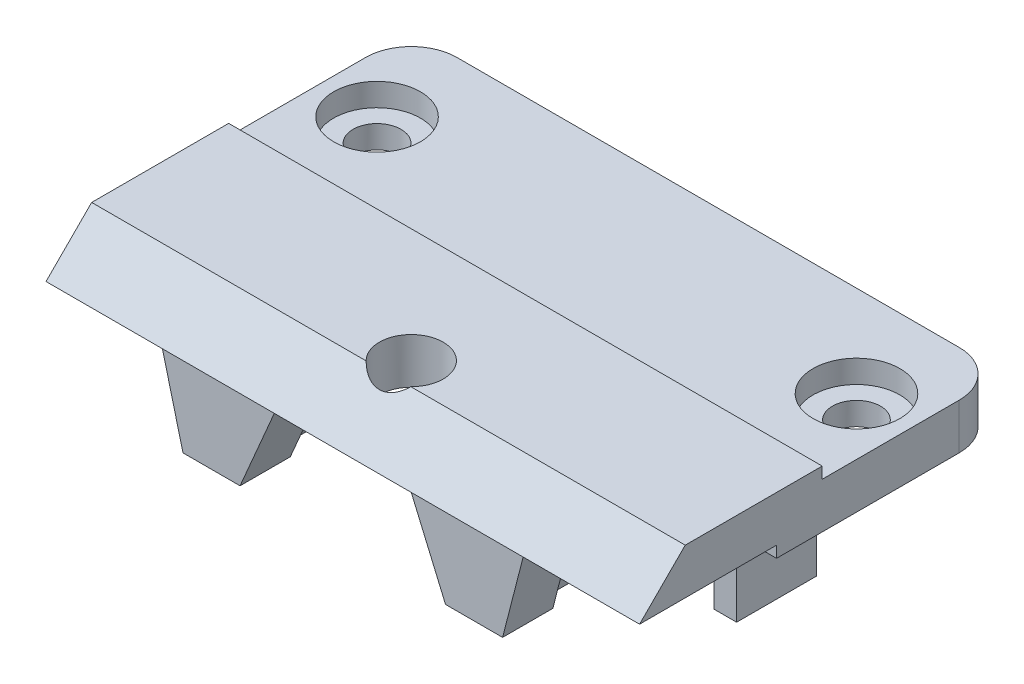
from build123d import *

# Parameters (mm, degrees)
SKETCH_1_W                   = 26
SKETCH_1_H                   = 16
EXTRUDE_1_DEPTH              = 2
EXTRUDE_3_DEPTH              = 6
CUT_EXTRUDE_1_REACH          = 18.225
SKETCH_5_R                   = 1.4
EXTRUDE_4_REACH              = 29.427
SKETCH_6_W                   = 10
SKETCH_6_H                   = 0.5
CUT_EXTRUDE_2_REACH          = 29.427
SKETCH_7_W                   = 8
SKETCH_7_H                   = 0.5
HOLE_WIZARD_M2_1_D           = 2.1
HOLE_WIZARD_M2_1_CBORE_D     = 3.8
HOLE_WIZARD_M2_1_CBORE_DEPTH = 1
SKETCH_10_W                  = 1
SKETCH_10_H                  = 3.5
EXTRUDE_5_DEPTH              = 3.3
CHAMFER_1_SIZE               = 2
FILLET_2_R                   = 2
CUT_EXTRUDE_3_DEPTH          = 0.8


with BuildPart() as part:
    # ｽｹｯﾁ1 → ﾎﾞｽ - 押し出し1 (new body)
    with BuildSketch(Plane(origin=(0, 0, 0), x_dir=(1, 0, 0), z_dir=(0, 1, 0))):
        Rectangle(SKETCH_1_W, SKETCH_1_H)
    extrude(amount=EXTRUDE_1_DEPTH)

    # ｽｹｯﾁ4 → ﾎﾞｽ - 押し出し3 (add)
    with BuildSketch(Plane.XY.offset(8)):
        Polygon((-7, -3.5), (-4.5, -3.5), (-3, 0), (-7.9, 0), align=None)
        Polygon((3, 0), (4.5, -3.5), (7, -3.5), (7.9, 0), align=None)
    extrude(amount=-EXTRUDE_3_DEPTH)

    # ｽｹｯﾁ5 → ｶｯﾄ - 押し出し1 (cut, up to next)
    with BuildSketch(Plane(origin=(0, 2, 0), x_dir=(1, 0, 0), z_dir=(0, 1, 0)), mode=Mode.PRIVATE) as cut_extrude_1_sk1:
        with Locations(Location((0, -5, 0), (0, 0, 270))):
            Circle(SKETCH_5_R)
    cut_extrude_1_tool1 = extrude(cut_extrude_1_sk1.sketch, amount=-CUT_EXTRUDE_1_REACH, mode=Mode.PRIVATE) & part.part
    add(cut_extrude_1_tool1.solids().sort_by_distance((0, 2, 5))[0], mode=Mode.SUBTRACT)

    # ﾎﾞｽ - 押し出し4: up to this face of the body (flat: up to its plane)
    extrude_4_end = Plane(part.part.faces().sort_by_distance((-13, 1, 0))[0])
    # ｽｹｯﾁ6 → ﾎﾞｽ - 押し出し4 (add, up to the picked face)
    with BuildSketch(Plane(origin=(13, 0, 0), x_dir=(0, 0, -1), z_dir=(1, 0, 0)), mode=Mode.PRIVATE) as extrude_4_sk1:
        with Locations((3, -0.25)):
            Rectangle(SKETCH_6_W, SKETCH_6_H)
    extrude_4_tool1 = split(extrude(extrude_4_sk1.sketch, amount=-EXTRUDE_4_REACH, mode=Mode.PRIVATE), bisect_by=extrude_4_end, keep=Keep.BOTH, mode=Mode.PRIVATE)
    add(extrude_4_tool1.solids().sort_by(Axis((13, -0.25, -3), (-1, 0, 0)))[0])

    # ｽｹｯﾁ7 → ｶｯﾄ - 押し出し2 (cut, up to next)
    with BuildSketch(Plane(origin=(13, 0, 0), x_dir=(0, 0, -1), z_dir=(1, 0, 0)), mode=Mode.PRIVATE) as cut_extrude_2_sk1:
        with Locations((4, 1.75)):
            Rectangle(SKETCH_7_W, SKETCH_7_H)
    cut_extrude_2_tool1 = extrude(cut_extrude_2_sk1.sketch, amount=-CUT_EXTRUDE_2_REACH, mode=Mode.PRIVATE) & part.part
    add(cut_extrude_2_tool1.solids().sort_by_distance((13, 1.75, -4))[0], mode=Mode.SUBTRACT)

    # M2 丸平ねじ用座ぐり穴1 (through all)
    with Locations(Plane(origin=(0, 1.5, 0), x_dir=(1, 0, 0), z_dir=(0, 1, 0))):
        with Locations((10.5, 4)):
            hole_wizard_m2_1 = CounterBoreHole(HOLE_WIZARD_M2_1_D / 2, HOLE_WIZARD_M2_1_CBORE_D / 2, HOLE_WIZARD_M2_1_CBORE_DEPTH)

    # ｽｹｯﾁ10 → ﾎﾞｽ - 押し出し5 (add)
    with BuildSketch(Plane.XZ.offset(0.5)):
        with Locations((10.75, 0.25)):
            Rectangle(SKETCH_10_W, SKETCH_10_H)
    extrude_5 = extrude(amount=EXTRUDE_5_DEPTH)

    # ﾐﾗｰ1: M2 丸平ねじ用座ぐり穴1, ﾎﾞｽ - 押し出し5 across plane
    add(hole_wizard_m2_1.mirror(Plane(origin=(0, 0, 0), x_dir=(0, 0, 1), z_dir=(1, 0, 0))), mode=Mode.SUBTRACT)
    add(extrude_5.mirror(Plane(origin=(0, 0, 0), x_dir=(0, 0, 1), z_dir=(1, 0, 0))))

    # 面取り1
    # the kernel refuses this chamfer: 2 mm, written as the material it takes off along each edge
    with BuildSketch(Plane(origin=(18.143365976, 2, 8), x_dir=(0, 0.02749587661058627, -0.9996219169112968), z_dir=(-1, 0, 0))) as chamfer_1_piece_1:
        Polygon((CHAMFER_1_SIZE * 0.999621916911, CHAMFER_1_SIZE * 0.0274958766106), (-CHAMFER_1_SIZE * 0.0274958766106, CHAMFER_1_SIZE * 0.999621916911), (0, 0), align=None)
    extrude(amount=36.286731952, mode=Mode.SUBTRACT)

    # ﾌｨﾚｯﾄ2
    fillet_2_edges = [part.edges().sort_by_distance(p)[0] for p in [
        (13, 0.5, -8),
        (-13, 0.5, -8),
    ]]
    fillet(fillet_2_edges, radius=FILLET_2_R)

    # ｽｹｯﾁ12 → ｶｯﾄ - 押し出し3 (cut, symmetric)
    with BuildSketch(Plane.XY.offset(5)):
        Polygon((-7.9, 0), (-7, -3.5), (-6.4, -3.5), (-7.3, 0), align=None)
        Polygon((-3, 0), (-4.5, -3.5), (-5.1, -3.5), (-3.6, 0), align=None)
    cut_extrude_3 = extrude(amount=CUT_EXTRUDE_3_DEPTH, both=True, mode=Mode.SUBTRACT)

    # ﾐﾗｰ2: ｶｯﾄ - 押し出し3 across plane
    add(cut_extrude_3.mirror(Plane(origin=(0, 0, 0), x_dir=(0, 0, 1), z_dir=(1, 0, 0))), mode=Mode.SUBTRACT)


solid = part.part
